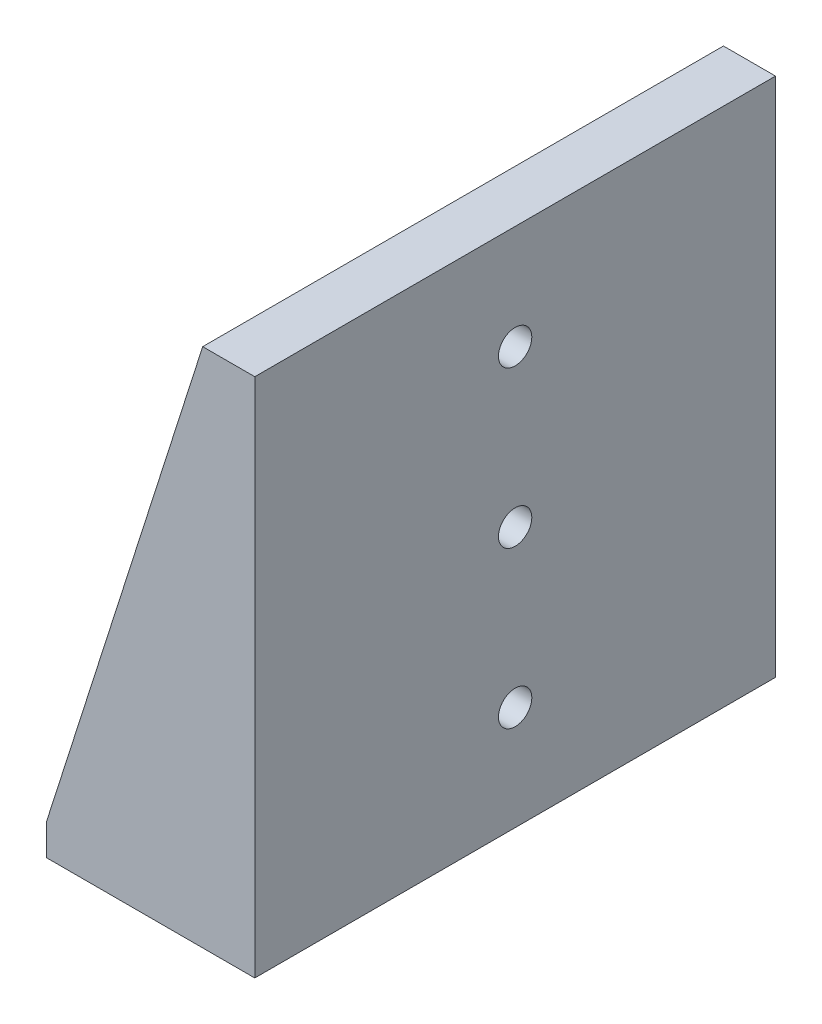
from build123d import *

# Parameters (mm, degrees)
BOSS_EXTRUDE1_DEPTH = 50
SKETCH4_W           = 45
SKETCH4_H           = 47.001372255
CUT_EXTRUDE2_DEPTH  = 15
SKETCH6_R           = 1.6
CUT_EXTRUDE4_DEPTH  = 5
CUT_EXTRUDE5_DEPTH  = 2.998627745
FILLET1_R           = 1


with BuildPart() as part:
    # Sketch1 → Boss-Extrude1 (new body)
    with BuildSketch(Plane.XY):
        Polygon((-10, 0), (10, 0), (10, 50), (5, 50), (-10, 3), align=None)
    extrude(amount=BOSS_EXTRUDE1_DEPTH)

    # Sketch4 → Cut-Extrude2 (cut)
    with BuildSketch(Plane.ZY.offset(10)):
        with Locations((25, 26.499313873)):
            Rectangle(SKETCH4_W, SKETCH4_H)
    extrude(amount=-CUT_EXTRUDE2_DEPTH, mode=Mode.SUBTRACT)

    # Sketch6 → Cut-Extrude4 (cut)
    with BuildSketch(Plane(origin=(10, 0, 0), x_dir=(0, 0, -1), z_dir=(1, 0, 0))):
        with Locations((-25, 25)):
            Circle(SKETCH6_R)
        with Locations((-25, 10)):
            Circle(SKETCH6_R)
        with Locations((-25, 40)):
            Circle(SKETCH6_R)
    extrude(amount=-CUT_EXTRUDE4_DEPTH, mode=Mode.SUBTRACT)

    # Sketch7 → Cut-Extrude5 (cut)
    with BuildSketch(Plane(origin=(0, 2.998627745, 0), x_dir=(1, 0, 0), z_dir=(0, 1, 0))):
        with BuildLine():
            Line((-7, -24), (3, -24))
            ThreePointArc((3, -24), (4, -25), (3, -26))
            Line((3, -26), (-7, -26))
            ThreePointArc((-7, -26), (-8, -25), (-7, -24))
        make_face()
    extrude(amount=-CUT_EXTRUDE5_DEPTH, mode=Mode.SUBTRACT)

    # Fillet1
    fillet1_edges = [part.edges().sort_by_distance(p)[0] for p in [
        (5, 2.998627745, 25),
        (-2.5, 2.998627745, 47.5),
        (-2.5, 2.998627745, 2.5),
    ]]
    fillet(fillet1_edges, radius=FILLET1_R - 0.0001)  # a hair under: the kernel refuses the full size


solid = part.part
